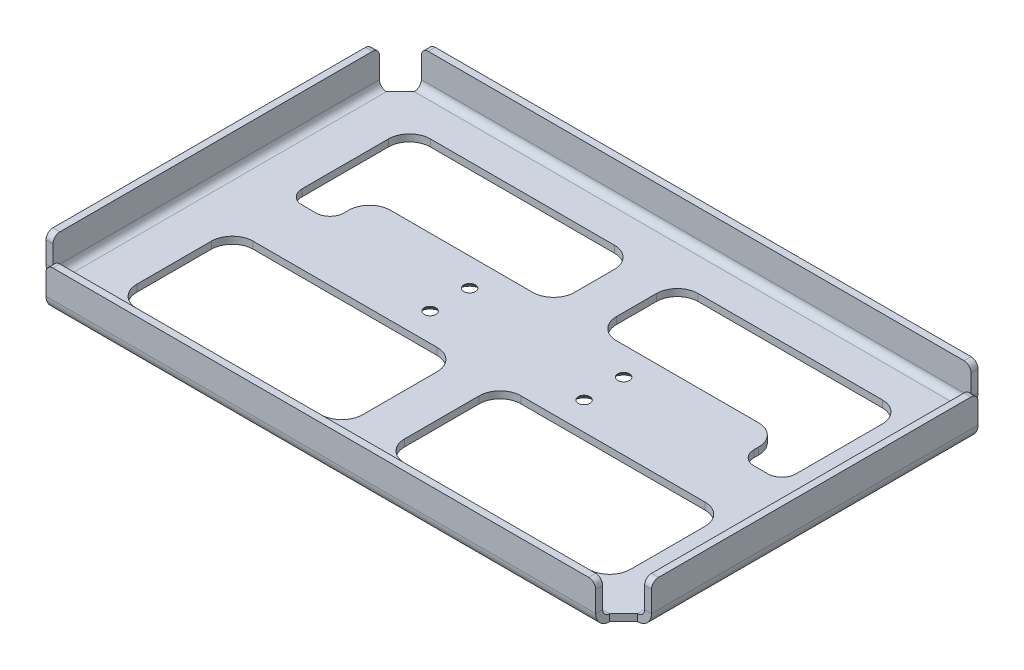
from build123d import *

# Parameters (mm, degrees)
SKETCH1_W                     = 262.636
SKETCH1_H                     = 3.175
BASE_FLANGE1_DEPTH            = 80.5688
CUT_EXTRUDE1_DEPTH            = 155.096817886
EDGE_FLANGE2_DEPTH            = 148.4376
EDGE_FLANGE3_DEPTH            = 249.936
EDGE_FLANGE4_DEPTH            = 148.4376
EDGE_FLANGE5_DEPTH            = 249.936
CSK_FOR_M5_SFHCS1_D           = 5.3
CSK_FOR_M5_SFHCS1_CSINK_D     = 11.2
CSK_FOR_M5_SFHCS1_CSINK_ANGLE = 90
CUT_EXTRUDE3_REACH            = 165.583
SKETCH18_W                    = 102.743
SKETCH18_H                    = 52.92295
FILLET2_R                     = 9.525
FILLET3_R                     = 6.35
FILLET4_R                     = 3.175


# Sheet-metal steps are written as plain solids
with BuildPart() as part:
    # Sketch1 → Base-Flange1 (new, symmetric)
    with BuildSketch(Plane.XY):
        with Locations((0, -1.5875)):
            Rectangle(SKETCH1_W, SKETCH1_H)
    extrude(amount=BASE_FLANGE1_DEPTH, both=True)

    # Sketch2 → Cut-Extrude1 (cut, through all)
    with BuildSketch(Plane(origin=(0, 0, 0), x_dir=(-1, 0, 0), z_dir=(0, 1, 0))):
        Polygon((131.318, -80.5688), (131.318, -74.2188), (124.968, -80.5688), align=None)
        Polygon((131.318, 74.2188), (124.968, 80.5688), (131.318, 80.5688), align=None)
        Polygon((-131.318, 80.5688), (-124.968, 80.5688), (-131.318, 74.2188), align=None)
        Polygon((-124.968, -80.5688), (-131.318, -80.5688), (-131.318, -74.2188), align=None)
    extrude(amount=-CUT_EXTRUDE1_DEPTH, mode=Mode.SUBTRACT)

    # Edge-Flange2 section (across the edge) → Edge-Flange2 (add)
    with BuildSketch(Plane(origin=(134.493, 0, 74.2188), x_dir=(-1, 0, 0), z_dir=(0, 0, -1))):
        with BuildLine():
            Line((-3.175, 3.175), (-3.175, 15.875))
            Line((-3.175, 15.875), (0, 15.875))
            Line((0, 15.875), (0, 3.175))
            ThreePointArc((0, 3.175), (0.92993597, 0.92993597), (3.175, 0))
            Line((3.175, 0), (3.175, -3.175))
            ThreePointArc((3.175, -3.175), (-1.315128061, -1.315128061), (-3.175, 3.175))
        make_face()
    extrude(amount=EDGE_FLANGE2_DEPTH)

    # Edge-Flange3 section (across the edge) → Edge-Flange3 (add)
    with BuildSketch(Plane(origin=(-124.968, 0, 83.7438), x_dir=(0, 0, -1), z_dir=(1, 0, 0))):
        with BuildLine():
            Line((-3.175, 3.175), (-3.175, 15.875))
            Line((-3.175, 15.875), (0, 15.875))
            Line((0, 15.875), (0, 3.175))
            ThreePointArc((0, 3.175), (0.92993597, 0.92993597), (3.175, 0))
            Line((3.175, 0), (3.175, -3.175))
            ThreePointArc((3.175, -3.175), (-1.315128061, -1.315128061), (-3.175, 3.175))
        make_face()
    extrude(amount=EDGE_FLANGE3_DEPTH)

    # Edge-Flange4 section (across the edge) → Edge-Flange4 (add)
    with BuildSketch(Plane(origin=(-134.493, 0, -74.2188), x_dir=(1, 0, 0), z_dir=(0, 0, 1))):
        with BuildLine():
            Line((-3.175, 3.175), (-3.175, 15.875))
            Line((-3.175, 15.875), (0, 15.875))
            Line((0, 15.875), (0, 3.175))
            ThreePointArc((0, 3.175), (0.92993597, 0.92993597), (3.175, 0))
            Line((3.175, 0), (3.175, -3.175))
            ThreePointArc((3.175, -3.175), (-1.315128061, -1.315128061), (-3.175, 3.175))
        make_face()
    extrude(amount=EDGE_FLANGE4_DEPTH)

    # Edge-Flange5 section (across the edge) → Edge-Flange5 (add)
    with BuildSketch(Plane(origin=(124.968, 0, -83.7438), x_dir=(0, 0, 1), z_dir=(-1, 0, 0))):
        with BuildLine():
            Line((-3.175, 3.175), (-3.175, 15.875))
            Line((-3.175, 15.875), (0, 15.875))
            Line((0, 15.875), (0, 3.175))
            ThreePointArc((0, 3.175), (0.92993597, 0.92993597), (3.175, 0))
            Line((3.175, 0), (3.175, -3.175))
            ThreePointArc((3.175, -3.175), (-1.315128061, -1.315128061), (-3.175, 3.175))
        make_face()
    extrude(amount=EDGE_FLANGE5_DEPTH)

    # CSK for M5 SFHCS1 (through all)
    with Locations(Plane.XZ.offset(3.175)):
        with Locations((-35, -15.75415), (35, -15.75415), (35, 2.24585), (-35, 2.24585)):
            CounterSinkHole(CSK_FOR_M5_SFHCS1_D / 2, CSK_FOR_M5_SFHCS1_CSINK_D / 2, counter_sink_angle=CSK_FOR_M5_SFHCS1_CSINK_ANGLE)

    # Sketch18 → Cut-Extrude3 (cut, up to next)
    with BuildSketch(Plane(origin=(0, 0, 0), x_dir=(1, 0, 0), z_dir=(0, 1, 0)), mode=Mode.PRIVATE) as cut_extrude3_sk1:
        with Locations((-60.8965, -41.407325)):
            Rectangle(SKETCH18_W, SKETCH18_H)
    cut_extrude3_tool1 = extrude(cut_extrude3_sk1.sketch, amount=-CUT_EXTRUDE3_REACH, mode=Mode.PRIVATE) & part.part
    # Sketch18 → Cut-Extrude3 (cut, up to next)
    with BuildSketch(Plane(origin=(0, 0, 0), x_dir=(1, 0, 0), z_dir=(0, 1, 0)), mode=Mode.PRIVATE) as cut_extrude3_sk2:
        with Locations((60.8965, -41.407325)):
            Rectangle(SKETCH18_W, SKETCH18_H)
    cut_extrude3_tool2 = extrude(cut_extrude3_sk2.sketch, amount=-CUT_EXTRUDE3_REACH, mode=Mode.PRIVATE) & part.part
    # Sketch18 → Cut-Extrude3 (cut, up to next)
    with BuildSketch(Plane(origin=(0, 0, 0), x_dir=(1, 0, 0), z_dir=(0, 1, 0)), mode=Mode.PRIVATE) as cut_extrude3_sk3:
        Polygon((-93.218, 28.45415), (-93.218, 10.45415), (-112.268, 10.45415), (-112.268, 65.62295), (-9.525, 65.62295), (-9.525, 28.45415), align=None)
    cut_extrude3_tool3 = extrude(cut_extrude3_sk3.sketch, amount=-CUT_EXTRUDE3_REACH, mode=Mode.PRIVATE) & part.part
    # Sketch18 → Cut-Extrude3 (cut, up to next)
    with BuildSketch(Plane(origin=(0, 0, 0), x_dir=(1, 0, 0), z_dir=(0, 1, 0)), mode=Mode.PRIVATE) as cut_extrude3_sk4:
        Polygon((9.525, 65.62295), (112.268, 65.62295), (112.268, 10.45415), (93.218, 10.45415), (93.218, 28.45415), (9.525, 28.45415), align=None)
    cut_extrude3_tool4 = extrude(cut_extrude3_sk4.sketch, amount=-CUT_EXTRUDE3_REACH, mode=Mode.PRIVATE) & part.part
    add(cut_extrude3_tool1.solids().sort_by_distance((-60.8965, 0, 41.407325))[0], mode=Mode.SUBTRACT)
    add(cut_extrude3_tool2.solids().sort_by_distance((60.8965, 0, 41.407325))[0], mode=Mode.SUBTRACT)
    add(cut_extrude3_tool3.solids().sort_by_distance((-64.344381, 0, -44.765774))[0], mode=Mode.SUBTRACT)
    add(cut_extrude3_tool4.solids().sort_by_distance((64.344381, 0, -44.765774))[0], mode=Mode.SUBTRACT)

    # Fillet2
    fillet2_edges = [part.edges().sort_by_distance(p)[0] for p in [
        (112.268, -1.5875, 14.94585),
        (112.268, -1.5875, 67.8688),
        (9.525, -1.5875, 67.8688),
        (9.525, -1.5875, 14.94585),
        (-112.268, -1.5875, -65.62295),
        (-9.525, -1.5875, -65.62295),
        (-9.525, -1.5875, -28.45415),
        (-93.218, -1.5875, -28.45415),
        (9.525, -1.5875, -28.45415),
        (9.525, -1.5875, -65.62295),
        (112.268, -1.5875, -65.62295),
        (93.218, -1.5875, -28.45415),
        (-9.525, -1.5875, 14.94585),
        (-9.525, -1.5875, 67.8688),
        (-112.268, -1.5875, 67.8688),
        (-112.268, -1.5875, 14.94585),
    ]]
    fillet(fillet2_edges, radius=FILLET2_R)

    # Fillet3
    fillet3_edges = [part.edges().sort_by_distance(p)[0] for p in [
        (-112.268, -1.5875, -10.45415),
        (-93.218, -1.5875, -10.45415),
        (112.268, -1.5875, -10.45415),
        (93.218, -1.5875, -10.45415),
    ]]
    fillet(fillet3_edges, radius=FILLET3_R)

    # Fillet4
    fillet4_edges = [part.edges().sort_by_distance(p)[0] for p in [
        (-136.0805, 15.875, -74.2188),
        (-136.0805, 15.875, 74.2188),
        (124.968, 15.875, -85.3313),
        (-124.968, 15.875, -85.3313),
        (136.0805, 15.875, 74.2188),
        (136.0805, 15.875, -74.2188),
        (-124.968, 15.875, 85.3313),
        (124.968, 15.875, 85.3313),
    ]]
    fillet(fillet4_edges, radius=FILLET4_R)


solid = part.part
